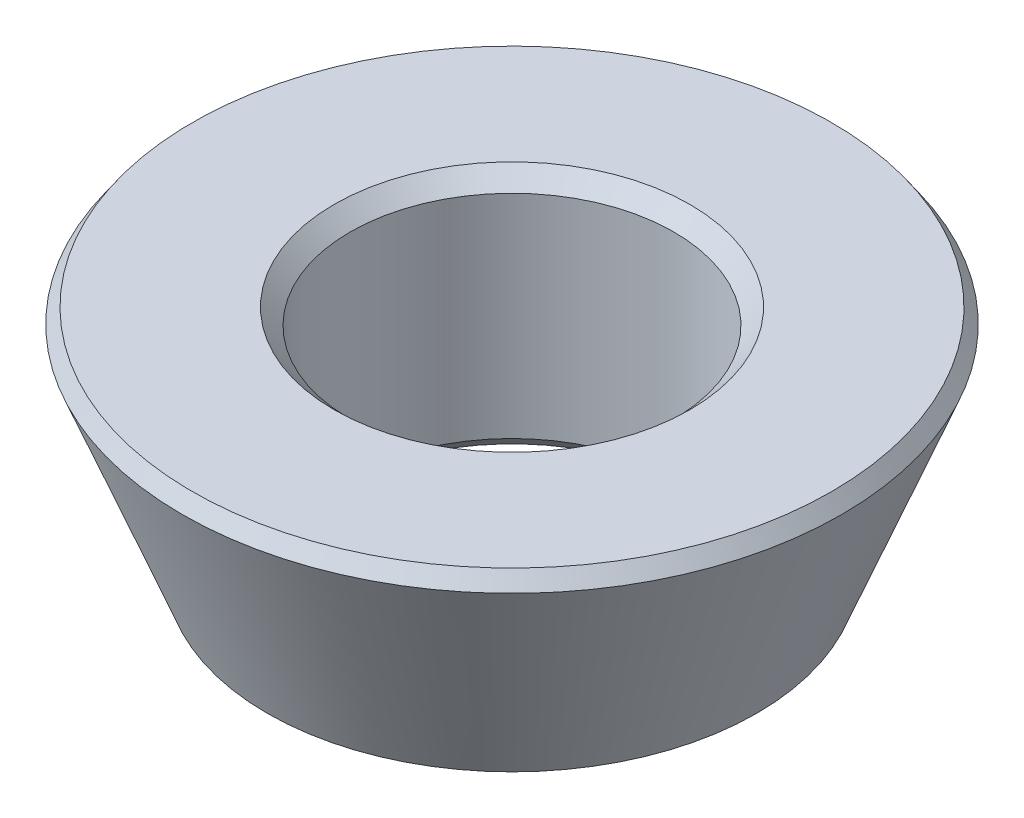
from build123d import *

# Parameters (mm, degrees)
CHAMFER3_SIZE = 0.3


with BuildPart() as part:
    # Sketch3 → Revolve1 (revolve)
    with BuildSketch(Plane.XY):
        Polygon((3.05, 4.6), (3.05, 0), (4.5, 0), (6.31983867, 4.6), align=None)
    revolve(axis=Axis((0, 4.6, 0), (0, -1, 0)))

    # Chamfer3
    chamfer3_edges = [part.edges().sort_by_distance(p)[0] for p in [
        (-3.05, 4.6, 0),
        (-3.05, 0, 0),
        (-4.5, 0, 0),
        (-6.31983867, 4.6, 0),
    ]]
    chamfer(chamfer3_edges, length=CHAMFER3_SIZE)


solid = part.part
